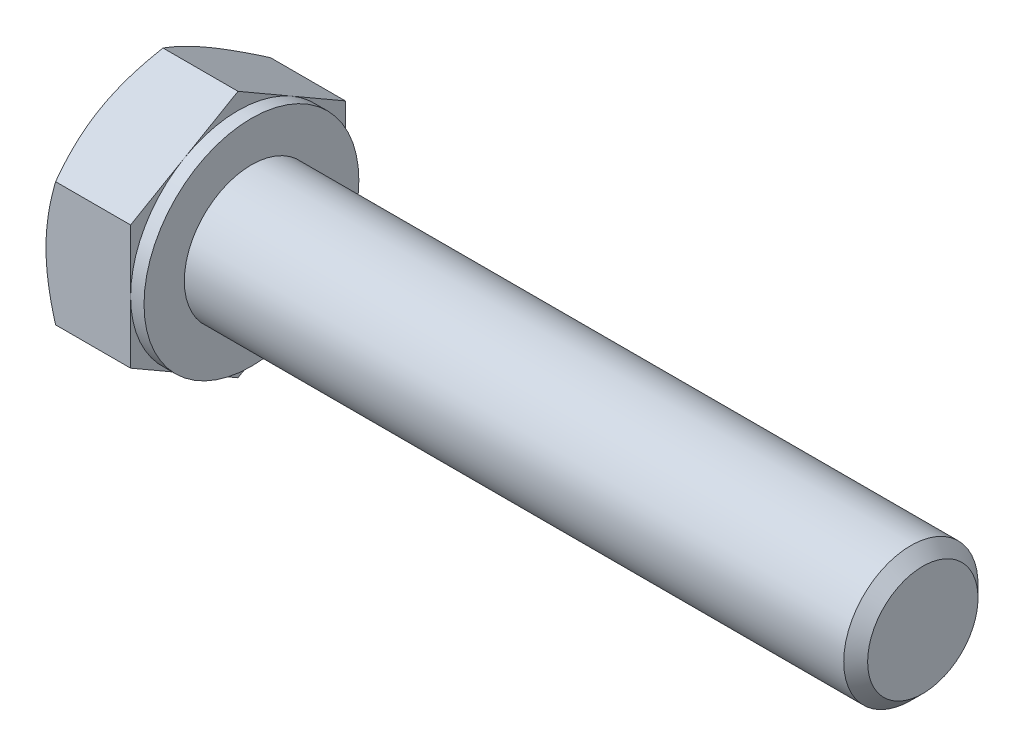
from build123d import *

# Parameters (mm, degrees)
BASEHEAD_DEPTH = 3.65
SKETCH4_W      = 0.5
SKETCH4_H      = 10.618802154


# Read off the part's stored shape, not the designer's step: HeadChamfer
with BuildPart() as part:
    # Sketch1 → BaseHead (new body)
    with BuildSketch(Plane(origin=(0, 0, 0), x_dir=(0, 0, -1), z_dir=(1, 0, 0))):
        Polygon((4, 2.309401077), (4, -2.309401077), (0, -4.618802154), (-4, -2.309401077), (-4, 2.309401077), (0, 4.618802154), align=None)
    extrude(amount=BASEHEAD_DEPTH)

    # HeadChamfer outline → HeadChamfer (revolve, cut)
    with BuildSketch(Plane.YX):
        Polygon((4.618802148, 0.357265587), (3.999999382, -3.57e-07), (4.618802154, -3.57e-07), align=None)
    revolve(axis=Axis((0, 0, 0), (1, 0, 0)), mode=Mode.SUBTRACT)

    # HeadChamfer 2 outline → HeadChamfer 2 (revolve)
    with BuildSketch(Plane.YX):
        Polygon((2.5, 3.65), (2.5, 28.205), (2.055, 28.65), (0, 28.65), (0, 3.65), align=None)
    revolve(axis=Axis((0, 0, 0), (1, 0, 0)))

    # Sketch4 → BearingFace (revolve, cut)
    with BuildSketch(Plane.XY, mode=Mode.PRIVATE) as bearingface_sk:
        with Locations((3.4, 9.309401077)):
            Rectangle(SKETCH4_W, SKETCH4_H)
    revolve(bearingface_sk.sketch.rotate(Axis((0, 0, 0), (1, 0, 0)), 90), axis=Axis((0, 0, 0), (1, 0, 0)), mode=Mode.SUBTRACT)


solid = part.part
